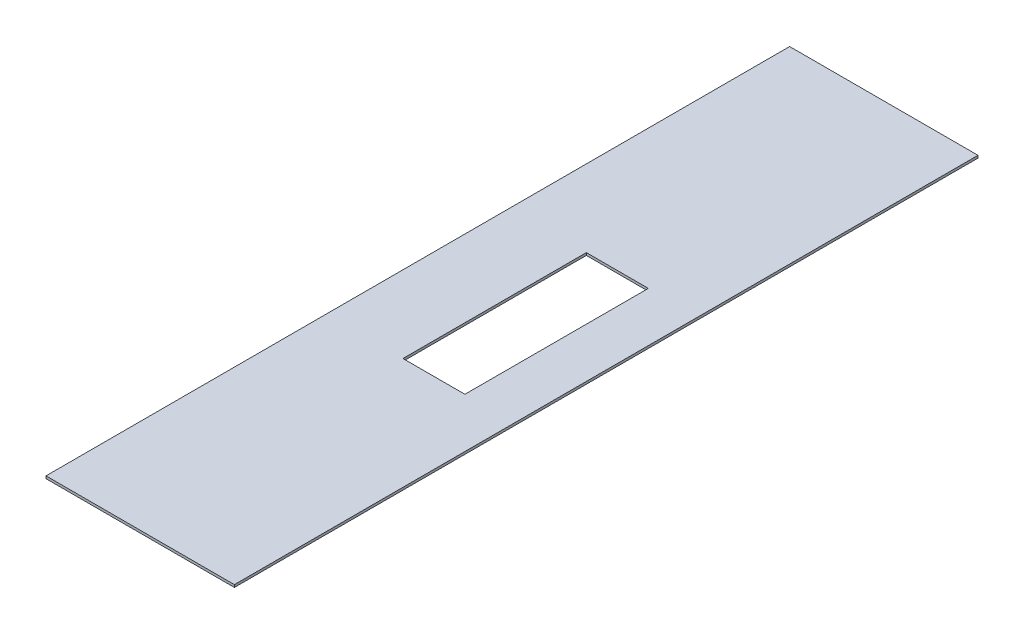
from build123d import *

# Parameters (mm, degrees)
SKIZZE1_W                       = 76
SKIZZE1_H                       = 1
LINEAR_AUSTRAGEN_D_NN1_DEPTH    = 300
SKIZZE2_W                       = 25
SKIZZE2_H                       = 74
SCHNITT_LINEAR_AUSTRAGEN1_DEPTH = 10


with BuildPart() as part:
    # Skizze1 → Linear-Austragen-Dünn1 (new body)
    with BuildSketch(Plane.XY):
        with Locations((38, -0.5)):
            Rectangle(SKIZZE1_W, SKIZZE1_H)
    extrude(amount=LINEAR_AUSTRAGEN_D_NN1_DEPTH)

    # Skizze2 → Schnitt-Linear austragen1 (cut)
    with BuildSketch(Plane.XZ.offset(1)):
        with Locations((43.5, 150)):
            Rectangle(SKIZZE2_W, SKIZZE2_H)
    extrude(amount=-SCHNITT_LINEAR_AUSTRAGEN1_DEPTH, mode=Mode.SUBTRACT)


solid = part.part
